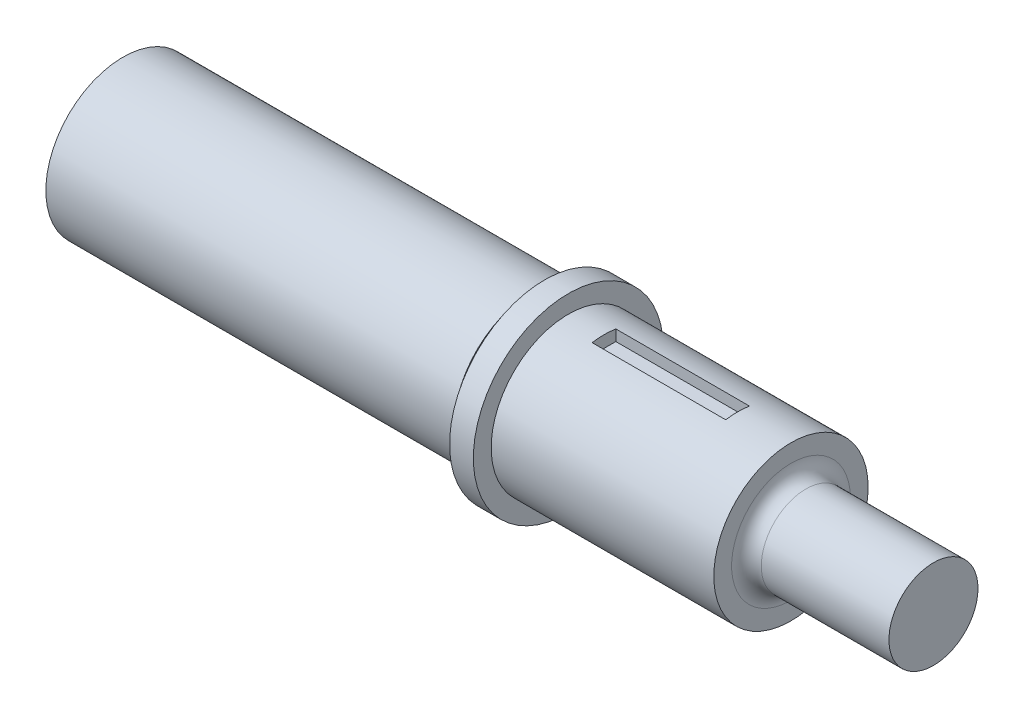
from build123d import *

# Parameters (mm, degrees)
SKETCH1_R                                = 26
BOSS_EXTRUDE1_DEPTH                      = 137.5
SKETCH2_R                                = 22
BOSS_EXTRUDE2_DEPTH                      = 4.5
SKETCH3_R                                = 32
BOSS_EXTRUDE3_DEPTH                      = 8
SKETCH4_R                                = 26
BOSS_EXTRUDE4_DEPTH                      = 75
F_12_0_12_DIAMETER_HOLE1_D               = 12
F_12_0_12_DIAMETER_HOLE1_DEPTH           = 23
F_12_0_12_DIAMETER_HOLE1_TIP             = 3.605163714
F_12_0_12_DIAMETER_HOLE1_ON_FACE_2_D     = 12
F_12_0_12_DIAMETER_HOLE1_ON_FACE_2_DEPTH = 23
F_12_0_12_DIAMETER_HOLE1_ON_FACE_2_TIP   = 3.605163714
SKETCH6_R                                = 15
BOSS_EXTRUDE5_DEPTH                      = 48
FILLET2_R                                = 5
CUT_EXTRUDE1_START                       = 26
SKETCH7_W                                = 45
SKETCH7_H                                = 8
CUT_EXTRUDE1_DEPTH                       = 4
M8_CLEARANCE_HOLE1_D                     = 8.4
M8_CLEARANCE_HOLE1_DEPTH                 = 13
M8_CLEARANCE_HOLE1_TIP                   = 2.5236146


with BuildPart() as part:
    # Sketch1 → Boss-Extrude1 (new body)
    with BuildSketch(Plane(origin=(0, 0, 0), x_dir=(0, 0, -1), z_dir=(1, 0, 0))):
        Circle(SKETCH1_R)
    extrude(amount=BOSS_EXTRUDE1_DEPTH)

    # Sketch2 → Boss-Extrude2 (add)
    with BuildSketch(Plane(origin=(137.5, 0, 0), x_dir=(0, 0, -1), z_dir=(1, 0, 0))):
        Circle(SKETCH2_R)
    extrude(amount=BOSS_EXTRUDE2_DEPTH)

    # Sketch3 → Boss-Extrude3 (add)
    with BuildSketch(Plane(origin=(142, 0, 0), x_dir=(0, 0, -1), z_dir=(1, 0, 0))):
        Circle(SKETCH3_R)
    extrude(amount=BOSS_EXTRUDE3_DEPTH)

    # Sketch4 → Boss-Extrude4 (add)
    with BuildSketch(Plane(origin=(150, 0, 0), x_dir=(0, 0, -1), z_dir=(1, 0, 0))):
        Circle(SKETCH4_R)
    extrude(amount=BOSS_EXTRUDE4_DEPTH)

    # Ø12.0 (12) Diameter Hole1
    with Locations(Plane(origin=(0, 0, 0), x_dir=(0, 0, -1), z_dir=(-1, 0, 0))):
        with Locations((0, 0)):
            Hole(F_12_0_12_DIAMETER_HOLE1_D / 2, depth=F_12_0_12_DIAMETER_HOLE1_DEPTH)
            with Locations((0, 0, -(F_12_0_12_DIAMETER_HOLE1_DEPTH + F_12_0_12_DIAMETER_HOLE1_TIP / 2))):  # 118° drill point
                Cone(0, F_12_0_12_DIAMETER_HOLE1_D / 2, F_12_0_12_DIAMETER_HOLE1_TIP, mode=Mode.SUBTRACT)

    # Ø12.0 (12) Diameter Hole1 on face 2
    with Locations(Plane(origin=(-153.563701333, 12.350945858, 0), x_dir=(0, 0, -1), z_dir=(-1, 0, 0))):
        with Locations((0, 0)):
            Hole(F_12_0_12_DIAMETER_HOLE1_ON_FACE_2_D / 2, depth=F_12_0_12_DIAMETER_HOLE1_ON_FACE_2_DEPTH)
            with Locations((0, 0, -(F_12_0_12_DIAMETER_HOLE1_ON_FACE_2_DEPTH + F_12_0_12_DIAMETER_HOLE1_ON_FACE_2_TIP / 2))):  # 118° drill point
                Cone(0, F_12_0_12_DIAMETER_HOLE1_ON_FACE_2_D / 2, F_12_0_12_DIAMETER_HOLE1_ON_FACE_2_TIP, mode=Mode.SUBTRACT)

    # Sketch6 → Boss-Extrude5 (add)
    with BuildSketch(Plane(origin=(225, 0, 0), x_dir=(0, 0, -1), z_dir=(1, 0, 0))):
        Circle(SKETCH6_R)
    extrude(amount=BOSS_EXTRUDE5_DEPTH)

    # Fillet2
    fillet2_edges = [part.edges().sort_by_distance(p)[0] for p in [
        (225, 0, 15),
    ]]
    fillet(fillet2_edges, radius=FILLET2_R)

    # Sketch7 → Cut-Extrude1 (cut)
    with BuildSketch(Plane(origin=(0, 0, 0), x_dir=(1, 0, 0), z_dir=(0, 1, 0)).offset(CUT_EXTRUDE1_START)):
        with Locations((184.5, 0)):
            Rectangle(SKETCH7_W, SKETCH7_H)
    extrude(amount=-CUT_EXTRUDE1_DEPTH, mode=Mode.SUBTRACT)

    # M8 Clearance Hole1
    with Locations(Plane.ZY):
        with Locations((0, -16)):
            Hole(M8_CLEARANCE_HOLE1_D / 2, depth=M8_CLEARANCE_HOLE1_DEPTH)
            with Locations((0, 0, -(M8_CLEARANCE_HOLE1_DEPTH + M8_CLEARANCE_HOLE1_TIP / 2))):  # 118° drill point
                Cone(0, M8_CLEARANCE_HOLE1_D / 2, M8_CLEARANCE_HOLE1_TIP, mode=Mode.SUBTRACT)


solid = part.part
